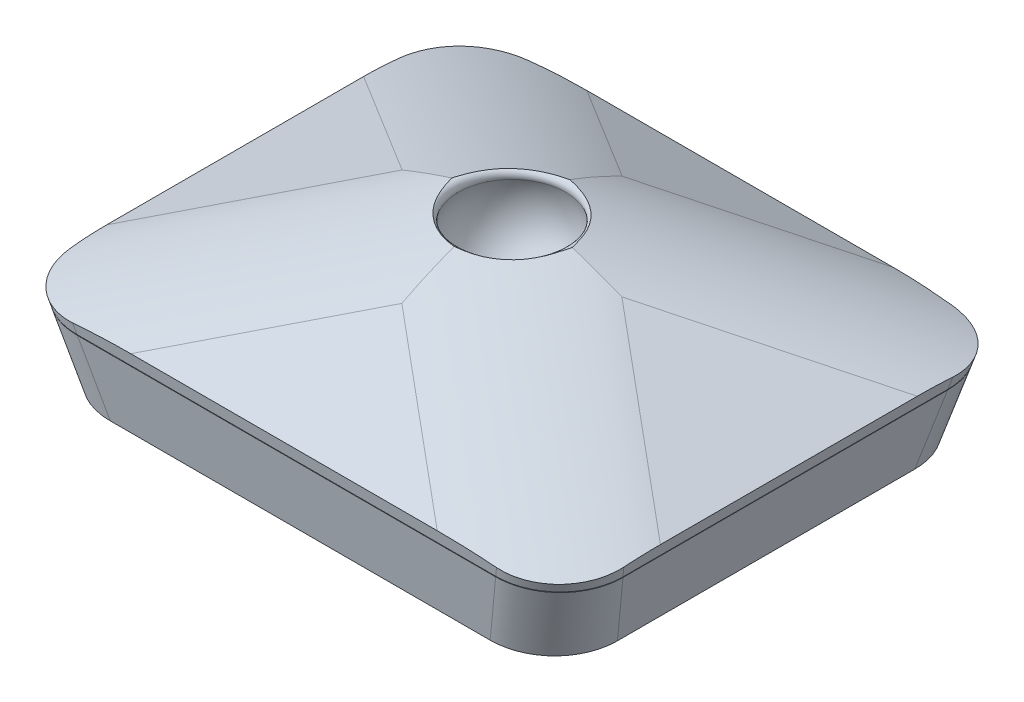
from build123d import *

# Parameters (mm, degrees)
SKETCH1_W               = 85
SKETCH1_H               = 70
BOSS_EXTRUDE1_DEPTH     = 26
CUT_EXTRUDE1_DEPTH      = 86.92002095
CUT_EXTRUDE2_DEPTH      = 86.92002095
CUT_EXTRUDE3_DEPTH      = 61.887190771
CUT_EXTRUDE3_DEPTH_BACK = 61.887190771
CUT_EXTRUDE4_DEPTH      = 61.887190771
CUT_EXTRUDE4_DEPTH_BACK = 61.887190771
SKETCH7_W               = 5
SKETCH7_H               = 5
CUT_EXTRUDE5_DEPTH      = 5
FILLET1_R               = 40
FILLET2_R               = 10
FILLET3_R               = 1
BOSS_EXTRUDE2_DEPTH     = 0.5
CUT_EXTRUDE7_START      = 35
SKETCH11_W              = 95
SKETCH11_H              = 0.1
CUT_EXTRUDE7_DEPTH      = 10
CUT_EXTRUDE8_START      = 42.5
SKETCH12_W              = 50
SKETCH12_H              = 0.1
CUT_EXTRUDE8_DEPTH      = 1
SKETCH13_R              = 2.5
SKETCH13_W              = 5
SKETCH13_H              = 7.5
CUT_EXTRUDE9_DEPTH      = 4
CUT_EXTRUDE10_DEPTH     = 0.5


with BuildPart() as part:
    # Sketch1 → Boss-Extrude1 (new body)
    with BuildSketch(Plane(origin=(0, 0, 0), x_dir=(1, 0, 0), z_dir=(0, 1, 0))):
        Rectangle(SKETCH1_W, SKETCH1_H)
    extrude(amount=BOSS_EXTRUDE1_DEPTH)

    # Sketch2 → Cut-Extrude1 (cut, through all)
    with BuildSketch(Plane.XY.offset(35)):
        Polygon((-39, 0), (-42.5, 0), (-42.5, 13), align=None)
        Polygon((39, 0), (42.5, 0), (42.5, 13), align=None)
    extrude(amount=-CUT_EXTRUDE1_DEPTH, mode=Mode.SUBTRACT)

    # Sketch3 → Cut-Extrude2 (cut, through all)
    with BuildSketch(Plane.XY.offset(35)):
        Polygon((-10, 26), (-42.5, 13), (-42.5, 26), align=None)
        Polygon((10, 26), (42.5, 13), (42.5, 26), align=None)
    extrude(amount=-CUT_EXTRUDE2_DEPTH, mode=Mode.SUBTRACT)

    # Sketch4 → Cut-Extrude3 (cut, two sides: drawn at the far end of the back side and taken through both)
    with BuildSketch(Plane(origin=(0, 0, 0), x_dir=(0, 0, -1), z_dir=(1, 0, 0)).offset(-CUT_EXTRUDE3_DEPTH_BACK)):
        Polygon((32.5, 0), (35, 13), (35, 0), align=None)
        Polygon((-32.5, 0), (-35, 13), (-35, 0), align=None)
    extrude(amount=CUT_EXTRUDE3_DEPTH + CUT_EXTRUDE3_DEPTH_BACK, mode=Mode.SUBTRACT)

    # Sketch5 → Cut-Extrude4 (cut, two sides: drawn at the far end of the back side and taken through both)
    with BuildSketch(Plane(origin=(0, 0, 0), x_dir=(0, 0, -1), z_dir=(1, 0, 0)).offset(-CUT_EXTRUDE4_DEPTH_BACK)):
        Polygon((10, 26), (35, 13), (35, 26), align=None)
        Polygon((-10, 26), (-35, 13), (-35, 26), align=None)
    extrude(amount=CUT_EXTRUDE4_DEPTH + CUT_EXTRUDE4_DEPTH_BACK, mode=Mode.SUBTRACT)

    # Sketch7 → Cut-Extrude5 (cut)
    with BuildSketch(Plane(origin=(0, 26, 0), x_dir=(1, 0, 0), z_dir=(0, 1, 0))):
        Rectangle(SKETCH7_W, SKETCH7_H)
    extrude(amount=-CUT_EXTRUDE5_DEPTH, mode=Mode.SUBTRACT)

    # Sketch8 → Cut-Revolve3 (revolve, cut)
    with BuildSketch(Plane(origin=(0, 21, 0), x_dir=(1, 0, 0), z_dir=(0, 1, 0))):
        with BuildLine():
            Line((-9, 0), (9, 0))
            ThreePointArc((9, 0), (0, 9), (-9, 0))
        make_face()
    revolve(axis=Axis((-17.101382006, 21, 0), (1, 0, 0)), mode=Mode.SUBTRACT)

    # Fillet1
    # the kernel refuses this fillet: 40 mm, written as the material it takes off along each edge
    with BuildSketch(Plane(origin=(-13.487478294, 35.394991318, 8.067290995), x_dir=(-0.6550810625309597, -0.34857902886565556, -0.6703442862801066), z_dir=(0.755558602302501, -0.30222344092100045, -0.5811989248480778)), Plane(origin=(-13.487478294, 35.394991318, -8.067290995), x_dir=(0.539629654489014, -0.2158518617956056, -0.8137615189694326), z_dir=(0.755558602302501, -0.3022234409210005, 0.581198924848078))) as fillet1_piece_1:
        with BuildLine():
            CenterArc((FILLET1_R * 0.310862429761, -FILLET1_R), FILLET1_R, 90, 34.537012927)
            Line((-FILLET1_R * 0.256076072353, -FILLET1_R * 0.176239880292), (0, 0))
            Line((0, 0), (FILLET1_R * 0.310862429761, 0))
        make_face()
    extrude(amount=105.18701838, mode=Mode.SUBTRACT)
    with BuildSketch(Plane(origin=(13.487478294, 35.394991318, 8.067290995), x_dir=(0.6550810625309597, -0.34857902886565556, -0.6703442862801066), z_dir=(-0.755558602302501, -0.30222344092100045, -0.5811989248480778)), Plane(origin=(13.487478294, 35.394991318, -8.067290995), x_dir=(-0.539629654489014, -0.2158518617956056, -0.8137615189694326), z_dir=(-0.755558602302501, -0.3022234409210005, 0.581198924848078))) as fillet1_piece_2:
        with BuildLine():
            CenterArc((FILLET1_R * 0.310862429761, FILLET1_R), FILLET1_R, 235.462987073, 34.537012927)
            Line((-FILLET1_R * 0.256076072353, FILLET1_R * 0.176239880292), (0, 0))
            Line((0, 0), (FILLET1_R * 0.310862429761, 0))
        make_face()
    extrude(amount=105.18701838, mode=Mode.SUBTRACT)

    # Fillet2
    fillet2_edges = [part.edges().sort_by_distance(p)[0] for p in [
        (-40.507776449, 5.600312524, -33.576983178),
        (40.507776449, 5.600312524, -33.576983178),
        (40.507776449, 5.600312524, 33.576983178),
        (-40.507776449, 5.600312524, 33.576983178),
    ]]
    fillet(fillet2_edges, radius=FILLET2_R)

    # Fillet3
    # the kernel refuses this fillet: 1 mm, written as the material it takes off along each edge
    with BuildSketch(Plane(origin=(0, 26, 0), x_dir=(0, 0, -1), z_dir=(-1, 0, 0))) as fillet3_piece_1:
        with BuildLine():
            CenterArc((9.16515139, 1), FILLET3_R, 156.421821522, 113.578178478)
            ThreePointArc((8.248636251, 1.4), (7.897060894, 0.683006921), (7.483314774, 0))
            Line((7.483314774, 0), (9.16515139, 0))
        make_face()
    revolve(axis=Axis((0, 26, 0), (0, -1, 0)), mode=Mode.SUBTRACT)

    # Sketch10 → Boss-Extrude2 (add)
    with BuildSketch(Plane.XZ):
        with BuildLine():
            Line((-29.152349123, 31.803152106), (29.152349123, 31.803152106))
            ThreePointArc((29.152349123, 31.803152106), (35.364432178, 29.031276619), (38.130749501, 22.816716453))
            Line((38.130749501, 22.816716453), (38.130749501, -22.816716453))
            ThreePointArc((38.130749501, -22.816716453), (35.364432178, -29.031276619), (29.152349123, -31.803152106))
            Line((29.152349123, -31.803152106), (-29.152349123, -31.803152106))
            ThreePointArc((-29.152349123, -31.803152106), (-35.364432178, -29.031276619), (-38.130749501, -22.816716453))
            Line((-38.130749501, -22.816716453), (-38.130749501, 22.816716453))
            ThreePointArc((-38.130749501, 22.816716453), (-35.364432178, 29.031276619), (-29.152349123, 31.803152106))
        make_face()
    extrude(amount=BOSS_EXTRUDE2_DEPTH)

    # Sketch11 → Cut-Extrude7 (cut)
    with BuildSketch(Plane.XY.offset(CUT_EXTRUDE7_START)):
        with Locations((0, 11)):
            Rectangle(SKETCH11_W, SKETCH11_H)
    cut_extrude7 = extrude(amount=-CUT_EXTRUDE7_DEPTH, mode=Mode.SUBTRACT)

    # Mirror1: Cut-Extrude7 across plane
    add(cut_extrude7.mirror(Plane.XY), mode=Mode.SUBTRACT)

    # Sketch12 → Cut-Extrude8 (cut)
    with BuildSketch(Plane(origin=(0, 0, 0), x_dir=(0, 0, -1), z_dir=(1, 0, 0)).offset(CUT_EXTRUDE8_START)):
        with Locations((0, 11)):
            Rectangle(SKETCH12_W, SKETCH12_H)
    cut_extrude8 = extrude(amount=-CUT_EXTRUDE8_DEPTH, mode=Mode.SUBTRACT)

    # Mirror2: Cut-Extrude8 across plane
    add(cut_extrude8.mirror(Plane(origin=(0, 0, 0), x_dir=(0, 0, 1), z_dir=(1, 0, 0))), mode=Mode.SUBTRACT)

    # Sketch13 → Cut-Extrude9 (cut)
    with BuildSketch(Plane.XZ.offset(0.5)):
        with Locations(Location((-33.75, 10, 0), (0, 0, 270))):
            Circle(SKETCH13_R)
        with Locations(Location((-33.75, -10, 0), (0, 0, 270))):
            Circle(SKETCH13_R)
        with Locations((-33.75, 0)):
            Rectangle(SKETCH13_W, SKETCH13_H)
    cut_extrude9 = extrude(amount=-CUT_EXTRUDE9_DEPTH, mode=Mode.SUBTRACT)

    # Mirror3: Cut-Extrude9 across plane
    add(cut_extrude9.mirror(Plane(origin=(0, 0, 0), x_dir=(0, 0, 1), z_dir=(1, 0, 0))), mode=Mode.SUBTRACT)

    # Sketch14 → Cut-Extrude10 (cut)
    with BuildSketch(Plane.XZ.offset(0.5)):
        with BuildLine():
            Line((-30.75002446, -10), (-30.75002446, 10))
            ThreePointArc((-30.75002446, 10), (-31.467937712, 11.947317374), (-33.278075043, 12.96262385))
            Line((-33.278075043, 12.96262385), (-38.130749501, 13.75))
            Line((-38.130749501, 13.75), (-38.130749501, -13.75))
            Line((-38.130749501, -13.75), (-33.269526851, -12.961249532))
            ThreePointArc((-33.269526851, -12.961249532), (-31.465130099, -11.944022318), (-30.75002446, -10))
        make_face()
    cut_extrude10 = extrude(amount=-CUT_EXTRUDE10_DEPTH, mode=Mode.SUBTRACT)

    # Mirror4: Cut-Extrude10 across plane
    add(cut_extrude10.mirror(Plane(origin=(0, 0, 0), x_dir=(0, 0, 1), z_dir=(1, 0, 0))), mode=Mode.SUBTRACT)


solid = part.part
